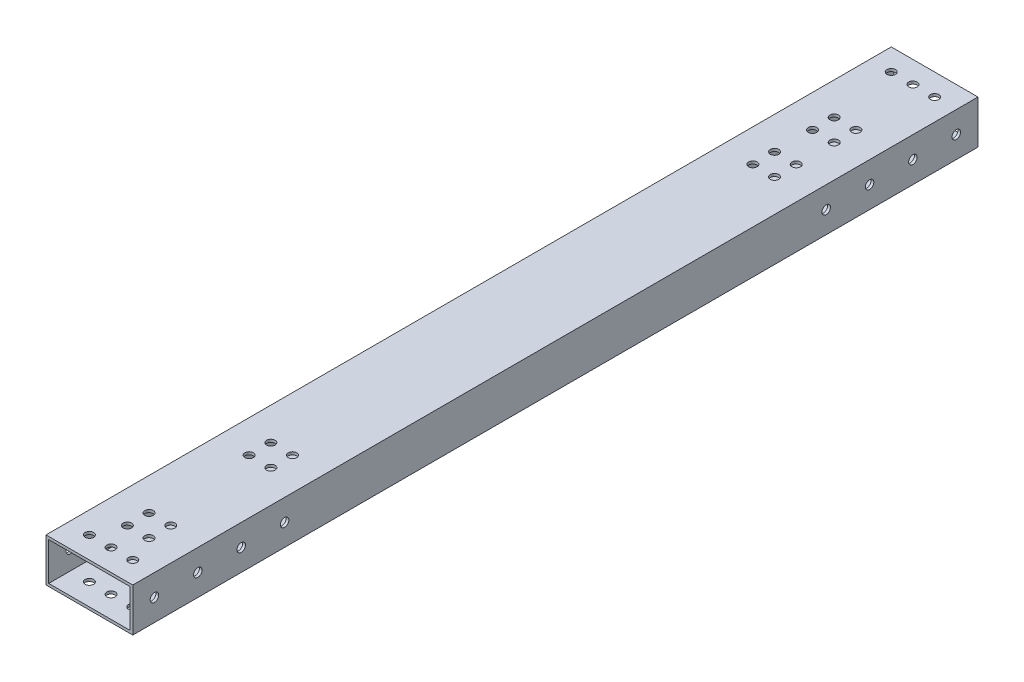
from build123d import *

# Parameters (mm, degrees)
SKETCH1_W           = 50.8
SKETCH1_H           = 25.4
SKETCH1_W_2         = 47.625
SKETCH1_H_2         = 22.225
BOSS_EXTRUDE1_DEPTH = 247.4595
SKETCH2_R           = 2.4892
CUT_EXTRUDE1_DEPTH  = 251.053042653
SKETCH3_R           = 2.4892
CUT_EXTRUDE2_DEPTH  = 253.938992922
SKETCH4_R           = 2.4892
CUT_EXTRUDE3_DEPTH  = 251.053042653


with BuildPart() as part:
    # Sketch1 → Boss-Extrude1 (new, symmetric)
    with BuildSketch(Plane.XY):
        Rectangle(SKETCH1_W, SKETCH1_H)
        Rectangle(SKETCH1_W_2, SKETCH1_H_2, mode=Mode.SUBTRACT)
    extrude(amount=BOSS_EXTRUDE1_DEPTH, both=True)

    # Sketch2 → Cut-Extrude1 (cut, through all)
    with BuildSketch(Plane(origin=(0, 12.7, 0), x_dir=(1, 0, 0), z_dir=(0, 1, 0))):
        with Locations((-12.7, 234.7595)):
            Circle(SKETCH2_R)
        with Locations((0, 234.7595)):
            Circle(SKETCH2_R)
        with Locations((12.7, 234.7595)):
            Circle(SKETCH2_R)
        with Locations((12.7, -234.7595)):
            Circle(SKETCH2_R)
        with Locations((0, -234.7595)):
            Circle(SKETCH2_R)
        with Locations((-12.7, -234.7595)):
            Circle(SKETCH2_R)
    extrude(amount=-CUT_EXTRUDE1_DEPTH, mode=Mode.SUBTRACT)

    # Sketch3 → Cut-Extrude2 (cut, through all)
    with BuildSketch(Plane(origin=(25.4, 0, 0), x_dir=(0, 0, -1), z_dir=(1, 0, 0))):
        with Locations((234.7595, 0)):
            Circle(SKETCH3_R)
        with Locations((-234.7595, 0)):
            Circle(SKETCH3_R)
        with Locations((209.3595, 0)):
            Circle(SKETCH3_R)
        with Locations((183.9595, 0)):
            Circle(SKETCH3_R)
        with Locations((158.5595, 0)):
            Circle(SKETCH3_R)
        with Locations((-158.5595, 0)):
            Circle(SKETCH3_R)
        with Locations((-183.9595, 0)):
            Circle(SKETCH3_R)
        with Locations((-209.3595, 0)):
            Circle(SKETCH3_R)
    extrude(amount=-CUT_EXTRUDE2_DEPTH, mode=Mode.SUBTRACT)

    # Sketch4 → Cut-Extrude3 (cut, through all)
    with BuildSketch(Plane(origin=(0, 12.7, 0), x_dir=(1, 0, 0), z_dir=(0, 1, 0))):
        with Locations((-6.35, 195.0085)):
            Circle(SKETCH4_R)
        with Locations((6.35, 195.0085)):
            Circle(SKETCH4_R)
        with Locations((-6.35, 182.3085)):
            Circle(SKETCH4_R)
        with Locations((6.35, 182.3085)):
            Circle(SKETCH4_R)
        with Locations((-6.35, 160.0835)):
            Circle(SKETCH4_R)
        with Locations((6.35, 160.0835)):
            Circle(SKETCH4_R)
        with Locations((-6.35, 147.3835)):
            Circle(SKETCH4_R)
        with Locations((6.35, 147.3835)):
            Circle(SKETCH4_R)
        with Locations((-6.35, -218.86164)):
            Circle(SKETCH4_R)
        with Locations((6.35, -218.86164)):
            Circle(SKETCH4_R)
        with Locations((-6.35, -206.16164)):
            Circle(SKETCH4_R)
        with Locations((6.35, -206.16164)):
            Circle(SKETCH4_R)
        with Locations((-6.35, -147.574)):
            Circle(SKETCH4_R)
        with Locations((-6.35, -134.874)):
            Circle(SKETCH4_R)
        with Locations((6.35, -147.574)):
            Circle(SKETCH4_R)
        with Locations((6.35, -134.874)):
            Circle(SKETCH4_R)
    extrude(amount=-CUT_EXTRUDE3_DEPTH, mode=Mode.SUBTRACT)


solid = part.part
